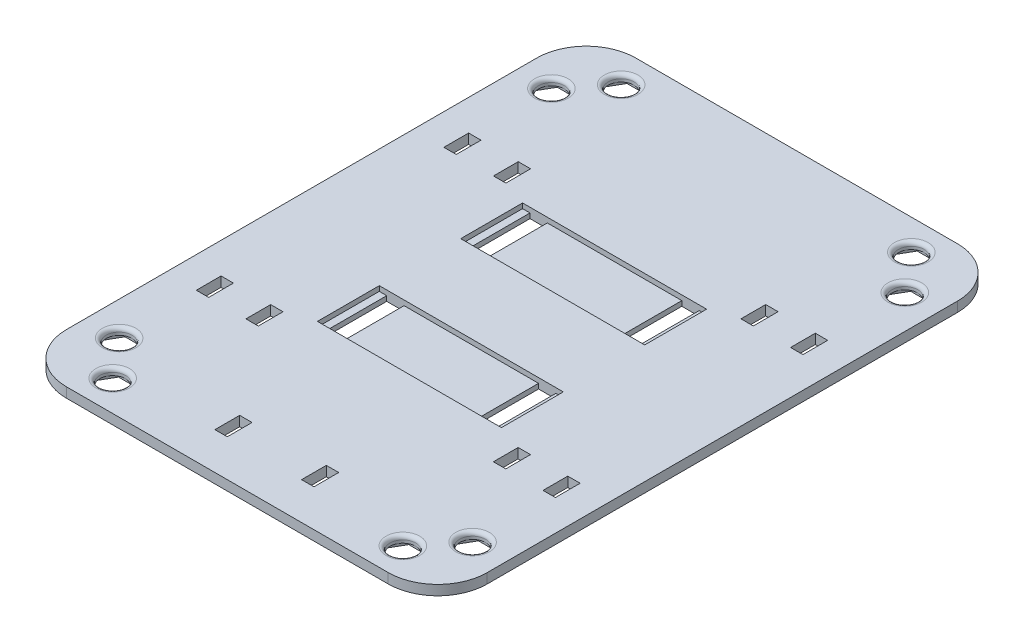
from build123d import *

# Parameters (mm, degrees)
SKETCH1_W           = 107.95
SKETCH1_H           = 146.05
BOSS_EXTRUDE1_DEPTH = 2.54
SKETCH2_R           = 3.302
CUT_EXTRUDE1_DEPTH  = 91.842736914
SKETCH3_W           = 4.445
SKETCH3_H           = 15.875
CUT_EXTRUDE2_DEPTH  = 91.842736914
FILLET1_R           = 12.7
SKETCH11_W          = 47.200058
SKETCH11_H          = 15.875
CUT_EXTRUDE9_DEPTH  = 1.27
FILLET2_R           = 1.016
SKETCH14_W          = 3.175
SKETCH14_H          = 6.35
CUT_EXTRUDE14_DEPTH = 91.842736914
CUT_EXTRUDE15_DEPTH = 0.79375


with BuildPart() as part:
    # Sketch1 → Boss-Extrude1 (new body)
    with BuildSketch(Plane(origin=(0, 0, 0), x_dir=(1, 0, 0), z_dir=(0, 1, 0))):
        Rectangle(SKETCH1_W, SKETCH1_H)
    extrude(amount=-BOSS_EXTRUDE1_DEPTH)

    # Sketch2 → Cut-Extrude1 (cut, through all)
    with BuildSketch(Plane(origin=(0, 0, 0), x_dir=(1, 0, 0), z_dir=(0, 1, 0))):
        with Locations((-37.218937681, 65.210784985)):
            Circle(SKETCH2_R)
        with Locations((45.326413441, 55.435363088)):
            Circle(SKETCH2_R)
        with Locations((37.218937681, 65.210784985)):
            Circle(SKETCH2_R)
        with Locations((-45.326413441, -55.435363088)):
            Circle(SKETCH2_R)
        with Locations((-45.326413441, 55.435363088)):
            Circle(SKETCH2_R)
        with Locations((-37.218937681, -65.210784985)):
            Circle(SKETCH2_R)
        with Locations((37.218937681, -65.210784985)):
            Circle(SKETCH2_R)
        with Locations((45.326413441, -55.435363088)):
            Circle(SKETCH2_R)
    extrude(amount=-CUT_EXTRUDE1_DEPTH, mode=Mode.SUBTRACT)

    # Sketch3 → Cut-Extrude2 (cut, through all)
    with BuildSketch(Plane(origin=(0, 0, 0), x_dir=(1, 0, 0), z_dir=(0, 1, 0))):
        with Locations((-19.472529, 18.374995)):
            Rectangle(SKETCH3_W, SKETCH3_H)
        with Locations((19.472529, 18.374995)):
            Rectangle(SKETCH3_W, SKETCH3_H)
        with Locations((19.472529, -18.374995)):
            Rectangle(SKETCH3_W, SKETCH3_H)
        with Locations((-19.472529, -18.374995)):
            Rectangle(SKETCH3_W, SKETCH3_H)
    extrude(amount=-CUT_EXTRUDE2_DEPTH, mode=Mode.SUBTRACT)

    # Fillet1
    fillet1_edges = [part.edges().sort_by_distance(p)[0] for p in [
        (53.975, -1.27, -73.025),
        (53.975, -1.27, 73.025),
        (-53.975, -1.27, 73.025),
        (-53.975, -1.27, -73.025),
    ]]
    fillet(fillet1_edges, radius=FILLET1_R)

    # Sketch11 → Cut-Extrude9 (cut, symmetric)
    with BuildSketch(Plane(origin=(0, 0, 0), x_dir=(1, 0, 0), z_dir=(0, 1, 0))):
        with Locations((0, -18.374995)):
            Rectangle(SKETCH11_W, SKETCH11_H)
        with Locations((0, 18.374995)):
            Rectangle(SKETCH11_W, SKETCH11_H)
    extrude(amount=CUT_EXTRUDE9_DEPTH, both=True, mode=Mode.SUBTRACT)

    # Fillet2
    fillet2_edges = [part.edges().sort_by_distance(p)[0] for p in [
        (-40.520937681, 0, -65.210784985),
        (33.916937681, 0, 65.210784985),
        (42.024413441, 0, 55.435363088),
        (-40.520937681, 0, 65.210784985),
        (-48.628413441, 0, 55.435363088),
        (42.024413441, 0, -55.435363088),
        (33.916937681, 0, -65.210784985),
        (-48.628413441, 0, -55.435363088),
    ]]
    fillet(fillet2_edges, radius=FILLET2_R)

    # Sketch14 → Cut-Extrude14 (cut, through all)
    with BuildSketch(Plane(origin=(0, 0, 0), x_dir=(1, 0, 0), z_dir=(0, 1, 0))):
        with Locations((31.7373, -31.75)):
            Rectangle(SKETCH14_W, SKETCH14_H)
        with Locations((-31.7373, -31.75)):
            Rectangle(SKETCH14_W, SKETCH14_H)
        with Locations((-31.7373, 31.75)):
            Rectangle(SKETCH14_W, SKETCH14_H)
        with Locations((31.7373, 31.75)):
            Rectangle(SKETCH14_W, SKETCH14_H)
        with Locations((-11.1125, -60.325)):
            Rectangle(SKETCH14_W, SKETCH14_H)
        with Locations((11.1125, -60.325)):
            Rectangle(SKETCH14_W, SKETCH14_H)
        with Locations((44.4627, 31.75)):
            Rectangle(SKETCH14_W, SKETCH14_H)
        with Locations((44.4627, -31.75)):
            Rectangle(SKETCH14_W, SKETCH14_H)
        with Locations((-44.4627, 31.75)):
            Rectangle(SKETCH14_W, SKETCH14_H)
        with Locations((-44.4627, -31.75)):
            Rectangle(SKETCH14_W, SKETCH14_H)
    extrude(amount=-CUT_EXTRUDE14_DEPTH, mode=Mode.SUBTRACT)

    # Sketch17 → Cut-Extrude15 (cut)
    with BuildSketch(Plane.XZ.offset(2.54)):
        Polygon((43.273355884, -51.879363088), (47.379470998, -51.879363088), (49.432528556, -55.435363088), (47.379470998, -58.991363088), (43.273355884, -58.991363088), (41.220298327, -55.435363088), align=None)
        Polygon((-41.220298327, -55.435363088), (-43.273355884, -51.879363088), (-47.379470998, -51.879363088), (-49.432528556, -55.435363088), (-47.379470998, -58.991363088), (-43.273355884, -58.991363088), align=None)
        Polygon((-33.112822567, -65.210784985), (-35.165880124, -61.654784985), (-39.271995239, -61.654784985), (-41.325052796, -65.210784985), (-39.271995239, -68.766784985), (-35.165880124, -68.766784985), align=None)
        Polygon((35.165880124, -61.654784985), (39.271995239, -61.654784985), (41.325052796, -65.210784985), (39.271995239, -68.766784985), (35.165880124, -68.766784985), (33.112822567, -65.210784985), align=None)
        Polygon((-41.220298327, 55.435363088), (-43.273355884, 51.879363088), (-47.379470998, 51.879363088), (-49.432528556, 55.435363088), (-47.379470998, 58.991363088), (-43.273355884, 58.991363088), align=None)
        Polygon((-33.112822567, 65.210784985), (-35.165880124, 61.654784985), (-39.271995239, 61.654784985), (-41.325052796, 65.210784985), (-39.271995239, 68.766784985), (-35.165880124, 68.766784985), align=None)
        Polygon((39.271995239, 68.766784985), (35.165880124, 68.766784985), (33.112822567, 65.210784985), (35.165880124, 61.654784985), (39.271995239, 61.654784985), (41.325052796, 65.210784985), align=None)
        Polygon((47.379470998, 58.991363088), (43.273355884, 58.991363088), (41.220298327, 55.435363088), (43.273355884, 51.879363088), (47.379470998, 51.879363088), (49.432528556, 55.435363088), align=None)
    extrude(amount=-CUT_EXTRUDE15_DEPTH, mode=Mode.SUBTRACT)


solid = part.part
